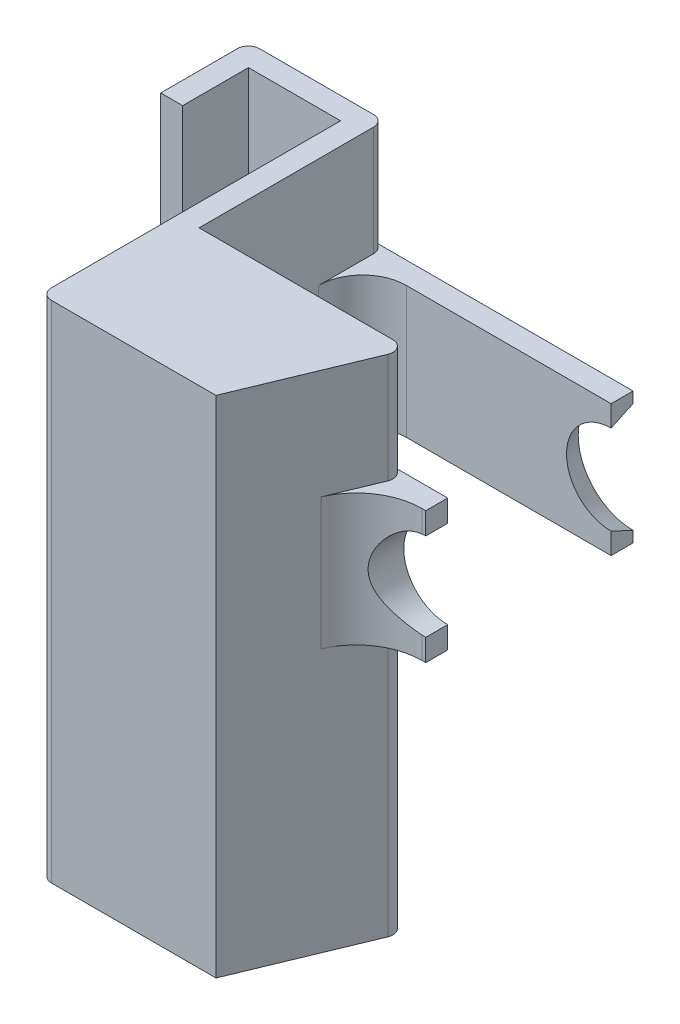
from build123d import *

# Parameters (mm, degrees)
EXTRUDE_1_DEPTH  = 115
FILLET_5_R       = 2.5
FILLET_6_R       = 2.5
FILLET_8_R       = 2.5
FILLET_10_R      = 2.5
FILLET_11_R      = 2.5
EXTRUDE_2_DEPTH  = 5
EXTRUDE_3_DEPTH  = 5
FILLET_12_R      = 10
CHAMFER_2_SIZE   = 5.361267301
CHAMFER_2_SIZE_2 = 2.5
EXTRUDE_5_DEPTH  = 5
FILLET_13_R      = 15


# Some blends are built 0.0001 mm under size
with BuildPart() as part:
    # ｽｹｯﾁ1 → ﾎﾞｽ - 押し出し1 (new body)
    with BuildSketch(Plane(origin=(0, 0, 0), x_dir=(1, 0, 0), z_dir=(0, 1, 0))):
        Polygon((47.807009209, -4.786582838), (36.65910681, -31.7), (5, -31.7), (5, 36.7), (-26, 36.7), (-26, 16.7), (-21, 16.7), (-21, 31.7), (0, 31.7), (0, -36.7), (40, -36.7), (52.426406871, -6.7), align=None)
    extrude(amount=EXTRUDE_1_DEPTH)

    # ﾌｨﾚｯﾄ5
    fillet_5_edges = [part.edges().sort_by_distance(p)[0] for p in [
        (-26, 57.5, -36.7),
    ]]
    fillet(fillet_5_edges, radius=FILLET_5_R)

    # ﾌｨﾚｯﾄ6
    fillet_6_edges = [part.edges().sort_by_distance(p)[0] for p in [
        (5, 57.5, -36.7),
    ]]
    fillet(fillet_6_edges, radius=FILLET_6_R)

    # ﾌｨﾚｯﾄ8
    fillet_8_edges = [part.edges().sort_by_distance(p)[0] for p in [
        (52.426406871, 57.5, 6.7),
        (47.807009209, 57.5, 4.786582838),
    ]]
    fillet(fillet_8_edges, radius=FILLET_8_R - 0.0001)  # a hair under: the kernel refuses the full size

    # ﾌｨﾚｯﾄ10
    fillet_10_edges = [part.edges().sort_by_distance(p)[0] for p in [
        (0, 57.5, 36.7),
    ]]
    fillet(fillet_10_edges, radius=FILLET_10_R)

    # ﾌｨﾚｯﾄ11
    fillet_11_edges = [part.edges().sort_by_distance(p)[0] for p in [
        (5, 57.5, 31.7),
    ]]
    fillet(fillet_11_edges, radius=FILLET_11_R)

    # ｽｹｯﾁ2 → ﾎﾞｽ - 押し出し2 (add)
    with BuildSketch(Plane(origin=(0, 115, 0), x_dir=(1, 0, 0), z_dir=(0, 1, 0))):
        with BuildLine():
            Line((49.159999459, -5.55299025), (40, -5.55299025))
            Line((40, -5.55299025), (5, -5.55299025))
            Line((5, -5.55299025), (5, -36.7))
            Line((5, -36.7), (40, -36.7))
            Line((40, -36.7), (51.46969829, -9.009698831))
            ThreePointArc((51.46969829, -9.009698831), (51.23867349, -6.664064668), (49.159999459, -5.55299025))
        make_face()
    extrude(amount=-EXTRUDE_2_DEPTH)

    # ｽｹｯﾁ3 → ﾎﾞｽ - 押し出し3 (add)
    with BuildSketch(Plane(origin=(0, 0, -36.7), x_dir=(-1, 0, 0), z_dir=(0, 0, -1))):
        with BuildLine():
            Line((6.851817904, 90), (-51.659999459, 90))
            Line((-51.659999459, 90), (-61.659999459, 90))
            Line((-61.659999459, 90), (-61.659999459, 85))
            ThreePointArc((-61.659999459, 85), (-51.659999459, 75), (-61.659999459, 65))
            Line((-61.659999459, 65), (-61.659999459, 60))
            Line((-61.659999459, 60), (-51.659999459, 60))
            Line((-51.659999459, 60), (6.851817904, 60))
            Line((6.851817904, 60), (6.851817904, 90))
        make_face()
    extrude(amount=-EXTRUDE_3_DEPTH)

    # ﾌｨﾚｯﾄ12
    fillet_12_edges = [part.edges().sort_by_distance(p)[0] for p in [
        (5, 75, -31.7),
    ]]
    fillet(fillet_12_edges, radius=FILLET_12_R)

    # 面取り2
    # the kernel refuses this chamfer: 5.361267301, 2.5 mm, written as the material it takes off along each edge
    with BuildSketch(Plane(origin=(61.659999459, 75, -36.7), x_dir=(0.9839382263976153, 0.1785092900482071, 0), z_dir=(0.1785092900482071, -0.9839382263976153, 0))) as chamfer_2_piece_1:
        Polygon((10, CHAMFER_2_SIZE), (10 + CHAMFER_2_SIZE_2, 0), (10, 0), align=None)
    revolve(axis=Axis((61.659999459, 75, -36.7), (0, 0, 1)), revolution_arc=339.434115604, mode=Mode.SUBTRACT)

    # ｽｹｯﾁ4 → ﾎﾞｽ - 押し出し5 (add)
    with BuildSketch(Plane(origin=(0, 0, 5.55299025), x_dir=(-1, 0, 0), z_dir=(0, 0, -1))):
        with BuildLine():
            Line((-46.850300628, 90), (-51.659999459, 90))
            Line((-51.659999459, 90), (-61.659999459, 90))
            Line((-61.659999459, 90), (-61.659999459, 85))
            ThreePointArc((-61.659999459, 85), (-51.659999459, 75), (-61.659999459, 65))
            Line((-61.659999459, 65), (-61.659999459, 60))
            Line((-61.659999459, 60), (-51.659999459, 60))
            Line((-51.659999459, 60), (-46.850300628, 60))
            Line((-46.850300628, 60), (-46.850300628, 90))
        make_face()
    extrude(amount=-EXTRUDE_5_DEPTH)

    # ﾌｨﾚｯﾄ13
    # the kernel refuses this fillet: 15 mm, written as the material it adds along each edge
    with BuildSketch(Plane(origin=(50.830446054, 90, 10.55299025), x_dir=(-0.3826834323650874, 0, 0.9238795325112876), z_dir=(0, -1, 0))) as fillet_13_piece_1_section:
        with BuildLine():
            CenterArc((FILLET_13_R * 0.668178637919, -FILLET_13_R), FILLET_13_R, 90, 67.5)
            Line((-FILLET_13_R * 0.255700894592, -FILLET_13_R * 0.617316567635), (0, 0))
            Line((0, 0), (FILLET_13_R * 0.668178637919, 0))
        make_face()
    fillet_13_piece_1 = extrude(amount=30, mode=Mode.PRIVATE)
    fillet_13_piece_1 = fillet_13_piece_1 - Plane(origin=(61.659999459, 75, 12.967680369), x_dir=(0, 1, 0), z_dir=(0, 0, -1)) * Cylinder(10, 101, mode=Mode.PRIVATE)
    add(fillet_13_piece_1)


solid = part.part
